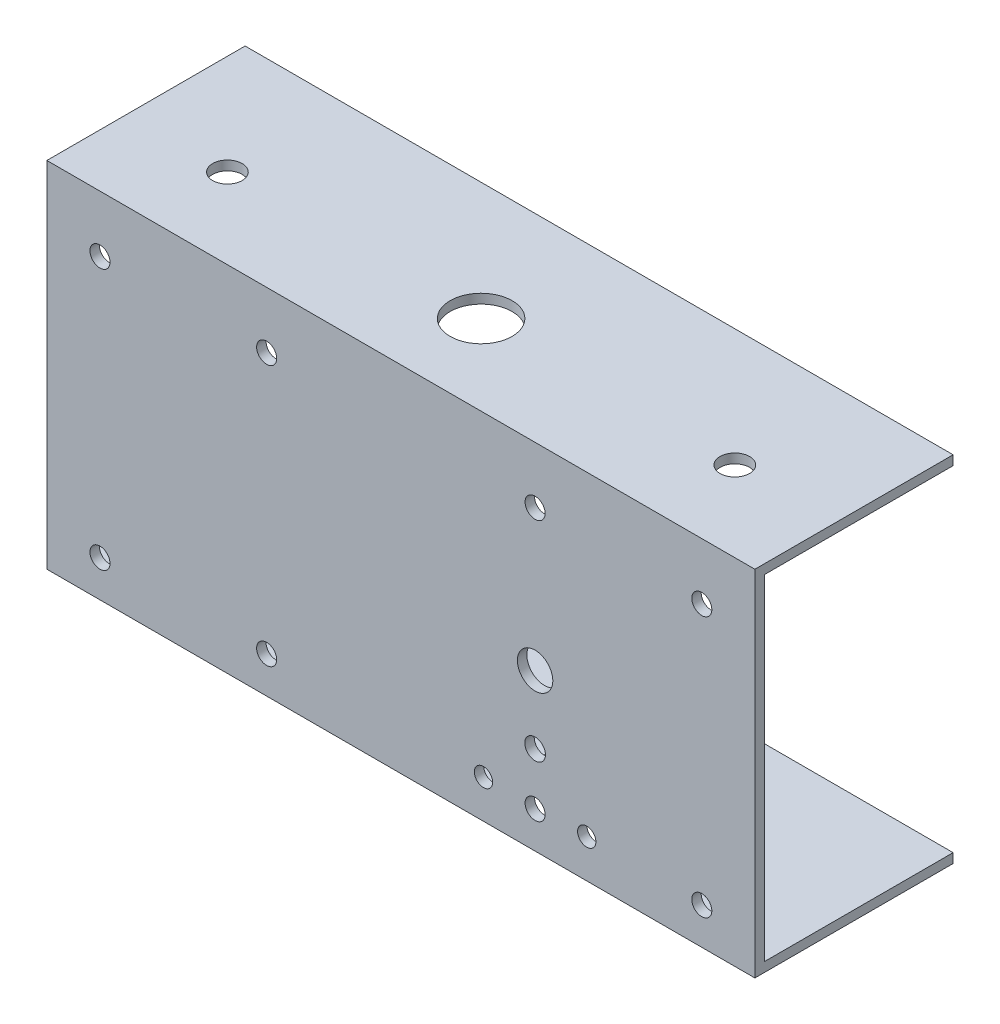
from build123d import *

# Parameters (mm, degrees)
SKETCH1_R           = 5.25
SKETCH1_R_2         = 2.5
BOSS_EXTRUDE1_DEPTH = 1.6
SKETCH3_W           = 120
SKETCH3_H           = 1.6
BOSS_EXTRUDE3_DEPTH = 60
SKETCH4_R           = 1.75
SKETCH4_R_2         = 3
SKETCH4_R_3         = 1.55
CUT_EXTRUDE1_DEPTH  = 10
SKETCH6_R           = 1.7
CUT_EXTRUDE2_DEPTH  = 25
SKETCH7_W           = 25.5
SKETCH7_H           = 1.6
BOSS_EXTRUDE4_DEPTH = 25


with BuildPart() as part:
    # Sketch1 → Boss-Extrude1 (new body)
    with BuildSketch(Plane(origin=(0, 0, 0), x_dir=(1, 0, 0), z_dir=(0, 1, 0))):
        Polygon((34.5, -12), (34.5, 13.5), (11, 13.5), (11, -12), (-60, -12), (-60, 20), (60, 20), (60, -12), align=None)
        Circle(SKETCH1_R, mode=Mode.SUBTRACT)
        with Locations((-43, 0)):
            Circle(SKETCH1_R_2, mode=Mode.SUBTRACT)
        with Locations((43, 0)):
            Circle(SKETCH1_R_2, mode=Mode.SUBTRACT)
    boss_extrude1 = extrude(amount=BOSS_EXTRUDE1_DEPTH)

    # Sketch3 → Boss-Extrude3 (add)
    with BuildSketch(Plane.XZ):
        with Locations((0, 12.8)):
            Rectangle(SKETCH3_W, SKETCH3_H)
    extrude(amount=-BOSS_EXTRUDE3_DEPTH)

    # Mirror1: Boss-Extrude1 across plane
    add(boss_extrude1.mirror(Plane.ZX.offset(30)))

    # Sketch4 → Cut-Extrude1 (cut)
    with BuildSketch(Plane.XY.offset(12)):
        with Locations((22.75, 15)):
            Circle(SKETCH4_R)
        with Locations((22.75, 26.5)):
            Circle(SKETCH4_R_2)
        with Locations((31.5, 6.5)):
            Circle(SKETCH4_R_3)
        with Locations((14, 6.5)):
            Circle(SKETCH4_R_3)
    extrude(amount=CUT_EXTRUDE1_DEPTH, mode=Mode.SUBTRACT)

    # Sketch6 → Cut-Extrude2 (cut)
    with BuildSketch(Plane(origin=(124.244525073, 40.7, 12), x_dir=(1, 0, 0), z_dir=(0, 0, 1))):
        with Locations((-73.244525073, -34.5)):
            Circle(SKETCH6_R)
        with Locations((-101.494525073, -34.5)):
            Circle(SKETCH6_R)
        with Locations((-146.994525073, -34.5)):
            Circle(SKETCH6_R)
        with Locations((-175.244525073, -34.5)):
            Circle(SKETCH6_R)
        with Locations((-73.244525073, 9.7)):
            Circle(SKETCH6_R)
        with Locations((-101.494525073, 9.7)):
            Circle(SKETCH6_R)
        with Locations((-146.994525073, 9.7)):
            Circle(SKETCH6_R)
        with Locations((-175.244525073, 9.7)):
            Circle(SKETCH6_R)
    extrude(amount=CUT_EXTRUDE2_DEPTH, mode=Mode.SUBTRACT)

    # Sketch7 → Boss-Extrude4 (add)
    with BuildSketch(Plane.ZY.offset(-34.5)):
        with Locations((-0.75, 59.2)):
            Rectangle(SKETCH7_W, SKETCH7_H)
    extrude(amount=BOSS_EXTRUDE4_DEPTH)


solid = part.part
